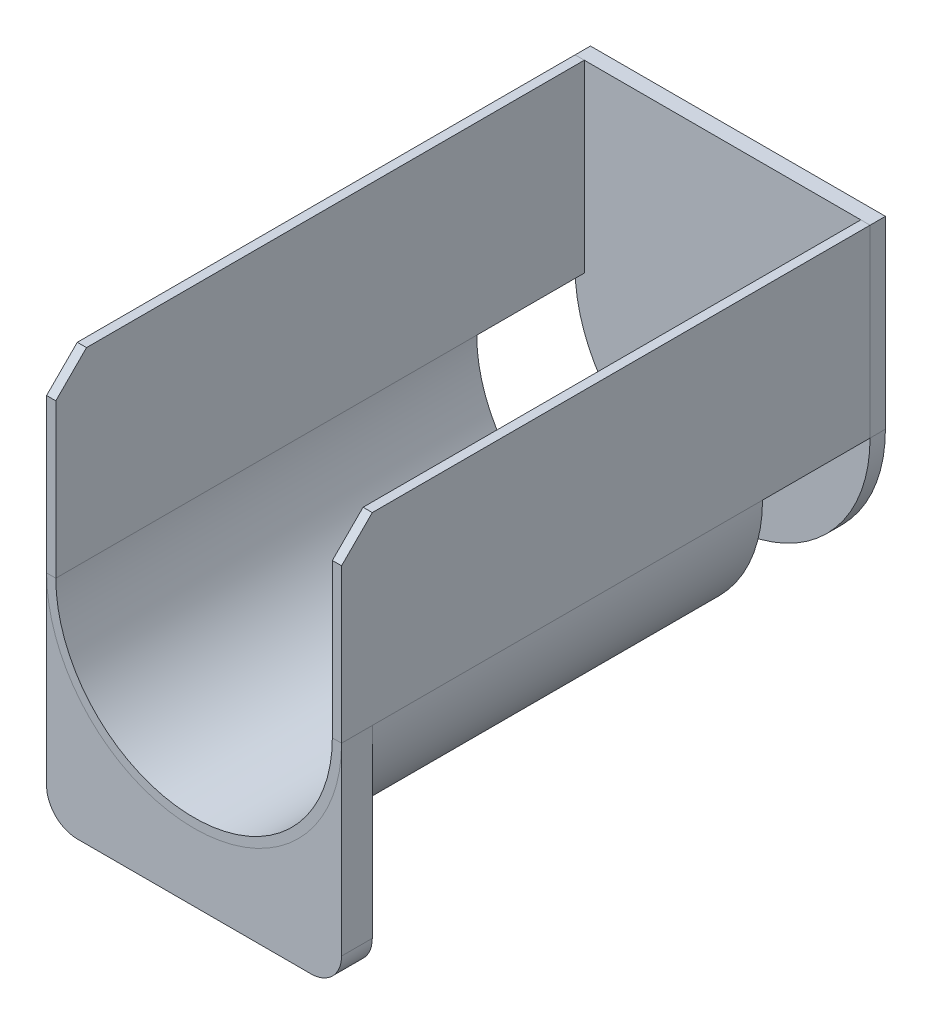
from build123d import *

# Parameters (mm, degrees)
BASE_FLANGE1_DEPTH  = 172
BOSS_EXTRUDE1_DEPTH = 5
SKETCH7_W           = 35
SKETCH7_H           = 48
CUT_EXTRUDE1_DEPTH  = 206.91260282
BOSS_EXTRUDE2_DEPTH = 10
FILLET1_R           = 10
CHAMFER1_SIZE       = 10


# Read off the part's stored shape, not the designer's step: Base-Flange1
with BuildPart() as part:
    # Base-Flange1 outline → Base-Flange1 (new body)
    with BuildSketch(Plane.XY):
        with BuildLine():
            Line((48, 0), (48, 60))
            Line((48, 60), (45, 60))
            Line((45, 60), (45, 0))
            ThreePointArc((45, 0), (0, -45), (-45, 0))
            Line((-45, 0), (-45, 60))
            Line((-45, 60), (-48, 60))
            Line((-48, 60), (-48, 0))
            ThreePointArc((-48, 0), (0, -48), (48, 0))
        make_face()
    extrude(amount=BASE_FLANGE1_DEPTH)

    # Sketch7 → Cut-Extrude1 (cut, through all)
    with BuildSketch(Plane.ZY.offset(48)):
        with Locations((17.5, -24)):
            Rectangle(SKETCH7_W, SKETCH7_H)
    extrude(amount=-CUT_EXTRUDE1_DEPTH, mode=Mode.SUBTRACT)

    # Chamfer1
    chamfer1_edges = [part.edges().sort_by_distance(p)[0] for p in [
        (-46.5, 60, 172),
        (46.5, 60, 172),
    ]]
    chamfer(chamfer1_edges, length=CHAMFER1_SIZE)


with BuildPart() as body_2:
    # Sketch6 → Boss-Extrude1 (new body)
    with BuildSketch(Plane(origin=(0, 0, 0), x_dir=(-1, 0, 0), z_dir=(0, 0, -1))):
        with BuildLine():
            Line((48, 60), (48, 0))
            ThreePointArc((48, 0), (0, -48), (-48, 0))
            Line((-48, 0), (-48, 60))
            Line((-48, 60), (48, 60))
        make_face()
    extrude(amount=BOSS_EXTRUDE1_DEPTH)


with BuildPart() as body_3:
    # Sketch8 → Boss-Extrude2 (new body)
    with BuildSketch(Plane.XY.offset(172)):
        with BuildLine():
            Line((-48, -70), (48, -70))
            Line((48, -70), (48, 0))
            ThreePointArc((48, 0), (0, -48), (-48, 0))
            Line((-48, 0), (-48, -70))
        make_face()
    extrude(amount=-BOSS_EXTRUDE2_DEPTH)

    # Fillet1
    fillet1_edges = [body_3.edges().sort_by_distance(p)[0] for p in [
        (-48, -70, 167),
        (48, -70, 167),
    ]]
    fillet(fillet1_edges, radius=FILLET1_R)


solid = Compound([part.part, body_2.part, body_3.part])
